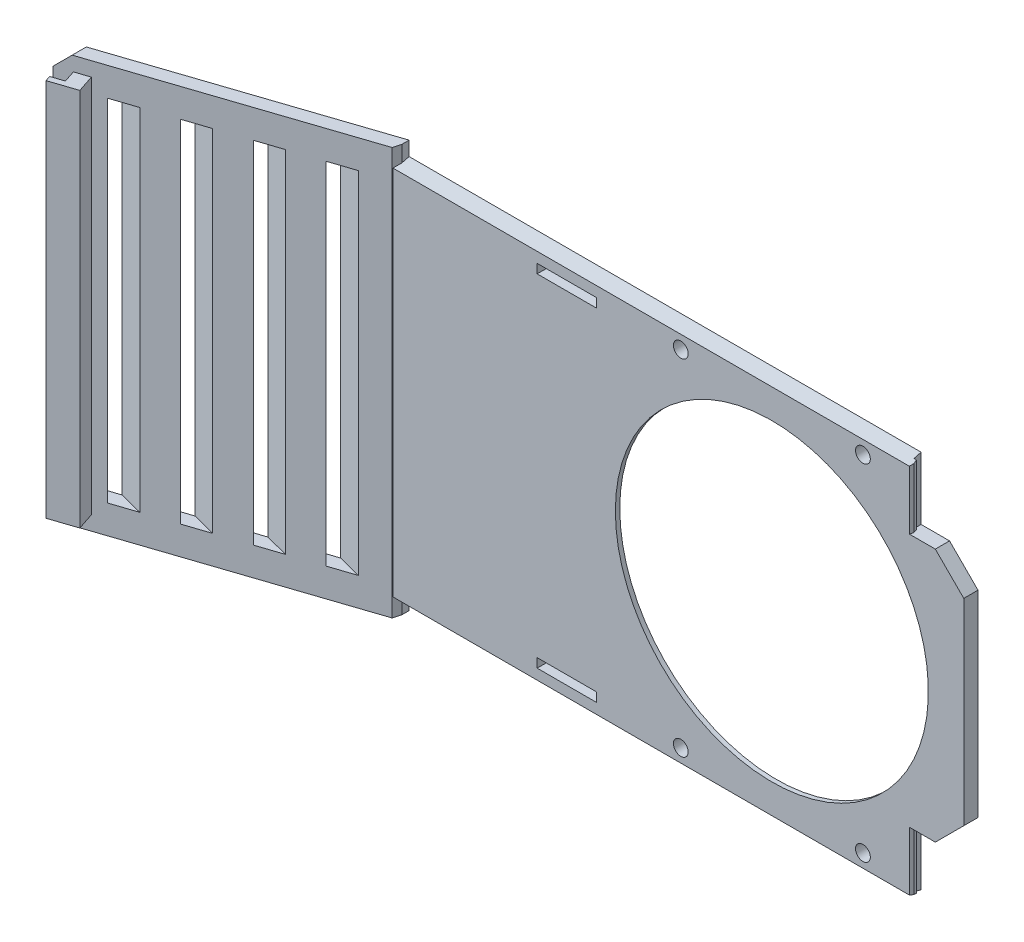
from build123d import *
from OCP.BRepFilletAPI import BRepFilletAPI_MakeChamfer

# Parameters (mm, degrees)
BOSS_EXTRUDE1_DEPTH = 84.582
BOSS_EXTRUDE2_DEPTH = 3.175
BOSS_EXTRUDE3_DEPTH = 3.175
SKETCH6_W           = 3.175
SKETCH6_H           = 84.582
BOSS_EXTRUDE4_DEPTH = 4.064
SKETCH7_W           = 1.27
SKETCH7_H           = 84.582
BOSS_EXTRUDE5_DEPTH = 2.794
SKETCH8_W           = 0.508
SKETCH8_H           = 78.232
CUT_EXTRUDE1_DEPTH  = 194.545554644
CHAMFER1_SIZE       = 4.88907126
CHAMFER1_SIZE_2     = 3.175
CHAMFER2_SIZE       = 4.88907126
CHAMFER2_SIZE_2     = 3.175
SKETCH11_W          = 3.175
SKETCH11_H          = 56.642
BOSS_EXTRUDE6_DEPTH = 12.7
CHAMFER3_SIZE       = 6.35
SKETCH10_R          = 34.925
SKETCH10_R_2        = 1.651
CUT_EXTRUDE2_DEPTH  = 12.7
CHAMFER4_SIZE       = 3.175
CHAMFER5_SIZE       = 3.175
CHAMFER5_SIZE_2     = 0.850738686
CHAMFER6_SIZE2      = 0.492353937
CHAMFER6_SIZE       = 1.5875
SKETCH12_W          = 13.208
SKETCH12_H          = 2.032
CUT_EXTRUDE3_DEPTH  = 206.621478571
SKETCH13_R          = 38.354
SKETCH13_R_2        = 0.226701536
CUT_EXTRUDE4_DEPTH  = 1.5875
CHAMFER8_SIZE       = 0.604625217
CHAMFER8_SIZE_2     = 3.429
BOSS_EXTRUDE7_DEPTH = 0.762
CHAMFER9_SIZE       = 0.79375
CHAMFER9_SIZE_2     = 0.212684671


# Some blends are built 0.0001 mm under size
with BuildPart() as part:
    # Sketch3 → Boss-Extrude1 (new body)
    with BuildSketch(Plane(origin=(0, 0, 0), x_dir=(1, 0, 0), z_dir=(0, 1, 0))):
        Polygon((0, 0), (57.196097427, 19.065365809), (171.45, 19.065365809), (171.45, 15.890365809), (57.15, 15.890365809), (0, -3.159634191), align=None)
    extrude(amount=BOSS_EXTRUDE1_DEPTH)

    # Sketch4 → Boss-Extrude2 (add)
    with BuildSketch(Plane(origin=(0, 84.582, 0), x_dir=(1, 0, 0), z_dir=(0, 1, 0))):
        Polygon((57.196097427, 19.065365809), (57.196097427, 15.905731618), (0, -3.159634191), (0, 0), align=None)
    extrude(amount=BOSS_EXTRUDE2_DEPTH)

    # Sketch5 → Boss-Extrude3 (add)
    with BuildSketch(Plane(origin=(0, 0, 0), x_dir=(-1, 0, 0), z_dir=(0, -1, 0))):
        Polygon((-57.196097427, 19.065365809), (-57.196097427, 15.905731618), (0, -3.159634191), (0, 0), align=None)
    extrude(amount=BOSS_EXTRUDE3_DEPTH)

    # Sketch6 → Boss-Extrude4 (add)
    with BuildSketch(Plane(origin=(0.947890257, 0, 2.843670772), x_dir=(0.9486832980505139, 0, -0.3162277660168379), z_dir=(0.3162277660168379, 0, 0.9486832980505139))):
        with Locations((4.144335938, 42.291)):
            Rectangle(SKETCH6_W, SKETCH6_H)
    extrude(amount=BOSS_EXTRUDE4_DEPTH)

    # Sketch7 → Boss-Extrude5 (add)
    with BuildSketch(Plane(origin=(2.425627551, 0, -0.808542517), x_dir=(0.31622776601683794, 0, 0.9486832980505139), z_dir=(-0.9486832980505139, 0, 0.31622776601683794))):
        with Locations((6.426492185, 42.291)):
            Rectangle(SKETCH7_W, SKETCH7_H)
    extrude(amount=BOSS_EXTRUDE5_DEPTH)

    # Sketch8 → Cut-Extrude1 (cut, through all)
    with BuildSketch(Plane(origin=(0, 0, 0), x_dir=(-0.9486832980505139, 0, 0.31622776601683794), z_dir=(-0.316227766016838, 0, -0.9486832980505139))):
        with Locations((-47.693985286, 42.291)):
            Rectangle(SKETCH8_W, SKETCH8_H)
        with Locations((-34.84399019, 42.291)):
            Rectangle(SKETCH8_W, SKETCH8_H)
        with Locations((-21.993995095, 42.291)):
            Rectangle(SKETCH8_W, SKETCH8_H)
        with Locations((-9.144, 42.291)):
            Rectangle(SKETCH8_W, SKETCH8_H)
    extrude(amount=-CUT_EXTRUDE1_DEPTH, mode=Mode.SUBTRACT)

    # Chamfer1
    # the kernel refuses this chamfer: 4.88907126, 3.175 mm, written as the material it takes off along each edge
    with BuildSketch(Plane(origin=(45.0055217, 3.175, -15.001840567), x_dir=(-0.955136727602259, 0, 0.2961652099508787), z_dir=(0, 1, 0)), Plane(origin=(32.814945973, 3.175, -10.938315324), x_dir=(-0.955136727602259, 0, 0.29616520995087847), z_dir=(0, 1, 0)), Plane(origin=(20.624370247, 3.175, -6.874790082), x_dir=(-0.9551367276022591, 0, 0.29616520995087875), z_dir=(0, 1, 0)), Plane(origin=(8.43379452, 3.175, -2.81126484), x_dir=(-0.9551367276022591, 0, 0.29616520995087847), z_dir=(0, 1, 0))) as chamfer1_piece_1:
        Polygon((CHAMFER1_SIZE * 0.999777923568, CHAMFER1_SIZE * 0.0210737654668), (-CHAMFER1_SIZE_2 * 0.0210737654663, CHAMFER1_SIZE_2 * 0.999777923546), (0, 0), align=None)
    extrude(amount=78.232, mode=Mode.SUBTRACT)

    # Chamfer2
    # the kernel refuses this chamfer: 4.88907126, 3.175 mm, written as the material it takes off along each edge
    with BuildSketch(Plane(origin=(46.435343073, 3.175, -12.3188135), x_dir=(0.9551367276022592, 0, -0.29616520995087836), z_dir=(0, 1, 0)), Plane(origin=(34.244767346, 3.175, -8.255288258), x_dir=(0.9551367276022591, 0, -0.29616520995087864), z_dir=(0, 1, 0)), Plane(origin=(22.054191619, 3.175, -4.191763015), x_dir=(0.955136727602259, 0, -0.29616520995087864), z_dir=(0, 1, 0)), Plane(origin=(9.863615892, 3.175, -0.128237773), x_dir=(0.955136727602259, 0, -0.29616520995087864), z_dir=(0, 1, 0))) as chamfer2_piece_1:
        Polygon((CHAMFER2_SIZE * 0.999777923568, CHAMFER2_SIZE * 0.0210737654668), (-CHAMFER2_SIZE_2 * 0.0210737654663, CHAMFER2_SIZE_2 * 0.999777923546), (0, 0), align=None)
    extrude(amount=78.232, mode=Mode.SUBTRACT)

    # Sketch11 → Boss-Extrude6 (add)
    with BuildSketch(Plane(origin=(171.45, 0, 0), x_dir=(0, 0, -1), z_dir=(1, 0, 0))):
        with Locations((17.477865809, 42.291)):
            Rectangle(SKETCH11_W, SKETCH11_H)
    extrude(amount=BOSS_EXTRUDE6_DEPTH)

    # Chamfer3
    chamfer3_edges = [part.edges().sort_by_distance(p)[0] for p in [
        (184.15, 13.97, -17.477865809),
        (184.15, 70.612, -17.477865809),
    ]]
    chamfer(chamfer3_edges, length=CHAMFER3_SIZE)

    # Sketch10 → Cut-Extrude2 (cut)
    with BuildSketch(Plane(origin=(0, 0, -19.065365809), x_dir=(-1, 0, 0), z_dir=(0, 0, -1))):
        with Locations((-141.3256, 42.291)):
            Circle(SKETCH10_R)
        with Locations((-161.6456, 80.772)):
            Circle(SKETCH10_R_2)
        with Locations((-121.0056, 80.772)):
            Circle(SKETCH10_R_2)
        with Locations((-121.0056, 3.81)):
            Circle(SKETCH10_R_2)
        with Locations((-161.6456, 3.81)):
            Circle(SKETCH10_R_2)
    extrude(amount=-CUT_EXTRUDE2_DEPTH, mode=Mode.SUBTRACT)

    # Chamfer4
    chamfer4_edges = [part.edges().sort_by_distance(p)[0] for p in [
        (0, 87.757, 1.579817095),
        (0, -3.175, 1.579817095),
    ]]
    chamfer(chamfer4_edges, length=CHAMFER4_SIZE)

    # Chamfer5
    chamfer5_edges_1 = [part.edges().sort_by_distance(p)[0] for p in [
        (114.3, 0, -15.890365809),
    ]]
    chamfer5_side_1 = [part.faces().sort_by_distance(p)[0] for p in [
        (114.3, 0, -15.907380583),
    ]]
    chamfer5_edges_2 = [part.edges().sort_by_distance(p)[0] for p in [
        (114.3, 84.582, -15.890365809),
    ]]
    chamfer5_side_2 = [part.faces().sort_by_distance(p)[0] for p in [
        (114.3, 84.582, -15.907380583),
    ]]
    chamfer5 = BRepFilletAPI_MakeChamfer(part.part.solid().wrapped)
    for e in chamfer5_edges_1:
        chamfer5.Add(CHAMFER5_SIZE - 0.0001, CHAMFER5_SIZE_2 - 0.0001, e.wrapped, chamfer5_side_1[0].wrapped)
    for e in chamfer5_edges_2:
        chamfer5.Add(CHAMFER5_SIZE - 0.0001, CHAMFER5_SIZE_2 - 0.0001, e.wrapped, chamfer5_side_2[0].wrapped)
    add(Compound.cast(chamfer5.Shape()), mode=Mode.REPLACE)  # a hair under: the kernel refuses the full size

    # Chamfer6
    chamfer6_edges = [part.edges().sort_by_distance(p)[0] for p in [
        (57.196097427, 85.746239108, -15.905731618),
    ]]
    chamfer6_side = [part.faces().sort_by_distance(p)[0] for p in [
        (57.196097427, 85.746239108, -15.915578697),
    ]]
    chamfer(chamfer6_edges, length=CHAMFER6_SIZE, length2=CHAMFER6_SIZE2, reference=chamfer6_side[0])

    # Sketch12 → Cut-Extrude3 (cut, through all)
    with BuildSketch(Plane(origin=(0, 0, -19.065365809), x_dir=(-1, 0, 0), z_dir=(0, 0, -1))):
        with Locations((-95.550097427, 80.391)):
            Rectangle(SKETCH12_W, SKETCH12_H)
        with Locations((-95.550097427, 4.191)):
            Rectangle(SKETCH12_W, SKETCH12_H)
    extrude(amount=-CUT_EXTRUDE3_DEPTH, mode=Mode.SUBTRACT)

    # Sketch13 → Cut-Extrude4 (cut)
    with BuildSketch(Plane(origin=(0, 0, -19.065365809), x_dir=(-1, 0, 0), z_dir=(0, 0, -1))):
        with Locations((-141.3256, 42.291)):
            Circle(SKETCH13_R)
        with Locations((-129.898704957, 9.528246972)):
            Circle(SKETCH13_R_2, mode=Mode.SUBTRACT)
    extrude(amount=-CUT_EXTRUDE4_DEPTH, mode=Mode.SUBTRACT)

    # Chamfer8
    # the kernel refuses this chamfer: 3.429, 0.604625217 mm, written as the material it takes off along each edge
    with BuildSketch(Plane(origin=(141.3256, 42.291, -17.477865809), x_dir=(-1, 0, 0), z_dir=(0, -1, 0))) as chamfer8_piece_1_section:
        Polygon((34.925, -CHAMFER8_SIZE), (34.925 + CHAMFER8_SIZE_2, 0), (34.925, 0), align=None)
    chamfer8_piece_1 = revolve(axis=Axis((141.3256, 42.291, -17.477865809), (0, 0, -1)), mode=Mode.PRIVATE)
    chamfer8_piece_1 = chamfer8_piece_1 & Plane(origin=(141.3256, 42.291, -17.229890684), x_dir=(-1, 0, 0), z_dir=(0, 0, -1)) * Cylinder(38.354, 154, mode=Mode.PRIVATE)
    add(chamfer8_piece_1, mode=Mode.SUBTRACT)

    # Sketch14 → Boss-Extrude7 (add)
    with BuildSketch(Plane(origin=(171.45, 0, 0), x_dir=(0, 0, -1), z_dir=(1, 0, 0))):
        Polygon((15.890365809, 70.612), (15.890365809, 83.731261314), (17.477865809, 84.156630657), (17.477865809, 70.612), align=None)
        Polygon((15.890365809, 13.97), (17.477865809, 13.97), (17.477865809, 0.425369343), (15.890365809, 0.850738686), align=None)
    extrude(amount=BOSS_EXTRUDE7_DEPTH)

    # Chamfer9
    chamfer9_edges_1 = [part.edges().sort_by_distance(p)[0] for p in [
        (172.212, 7.197684671, -17.477865809),
    ]]
    chamfer9_side_1 = [part.faces().sort_by_distance(p)[0] for p in [
        (172.212, 7.197684671, -17.473612116),
    ]]
    chamfer9_edges_2 = [part.edges().sort_by_distance(p)[0] for p in [
        (172.212, 7.410369343, -15.890365809),
    ]]
    chamfer9_side_2 = [part.faces().sort_by_distance(p)[0] for p in [
        (172.207746307, 7.410369343, -15.890365809),
    ]]
    chamfer9_edges_3 = [part.edges().sort_by_distance(p)[0] for p in [
        (172.212, 77.384315329, -17.477865809),
    ]]
    chamfer9_side_3 = [part.faces().sort_by_distance(p)[0] for p in [
        (172.207746307, 77.384315329, -17.477865809),
    ]]
    chamfer9_edges_4 = [part.edges().sort_by_distance(p)[0] for p in [
        (172.212, 77.171630657, -15.890365809),
    ]]
    chamfer9_side_4 = [part.faces().sort_by_distance(p)[0] for p in [
        (172.207746307, 77.171630657, -15.890365809),
    ]]
    chamfer9 = BRepFilletAPI_MakeChamfer(part.part.solid().wrapped)
    for e in chamfer9_edges_1:
        chamfer9.Add(CHAMFER9_SIZE - 0.0001, CHAMFER9_SIZE_2 - 0.0001, e.wrapped, chamfer9_side_1[0].wrapped)
    for e in chamfer9_edges_2:
        chamfer9.Add(CHAMFER9_SIZE_2 - 0.0001, CHAMFER9_SIZE - 0.0001, e.wrapped, chamfer9_side_2[0].wrapped)
    for e in chamfer9_edges_3:
        chamfer9.Add(CHAMFER9_SIZE_2 - 0.0001, CHAMFER9_SIZE - 0.0001, e.wrapped, chamfer9_side_3[0].wrapped)
    for e in chamfer9_edges_4:
        chamfer9.Add(CHAMFER9_SIZE_2 - 0.0001, CHAMFER9_SIZE - 0.0001, e.wrapped, chamfer9_side_4[0].wrapped)
    add(Compound.cast(chamfer9.Shape()), mode=Mode.REPLACE)  # a hair under: the kernel refuses the full size


solid = part.part
